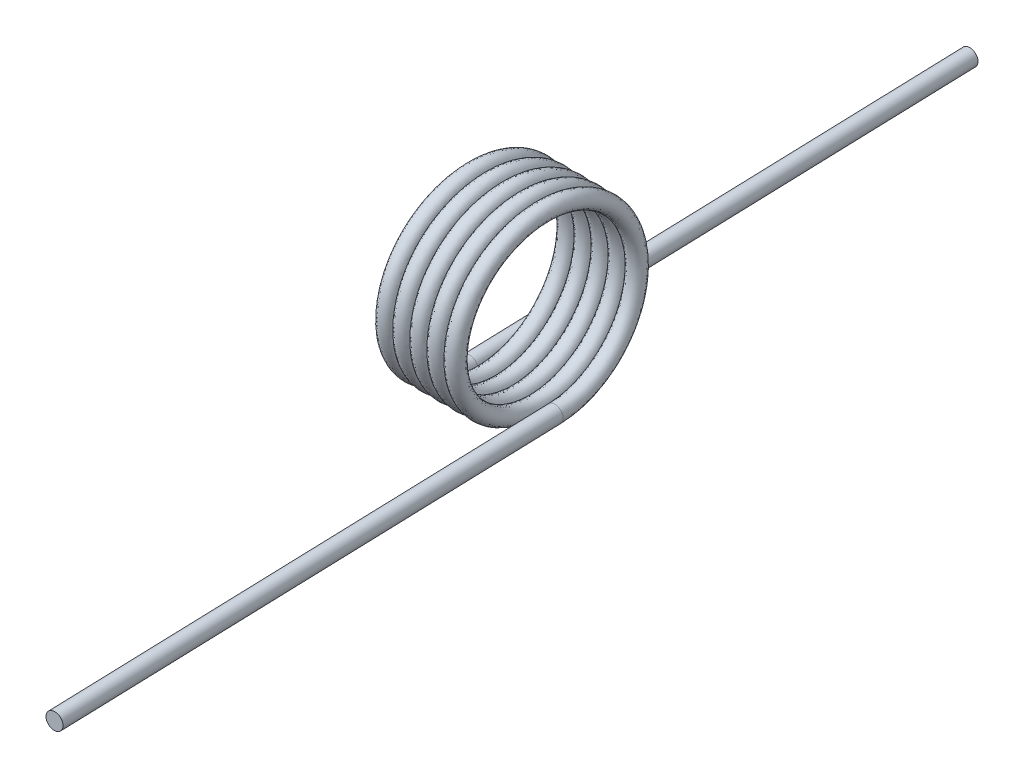
from build123d import *

# Parameters (mm, degrees)
SWEEP1_PITCH       = 0.8382
SWEEP1_HEIGHT      = 4.191
SWEEP1_RADIUS      = 4.2418
SWEEP1_START_ANGLE = 90
SKETCH2_R          = 0.4064
SKETCH3_R          = 0.4064
EXTRUDE1_DEPTH     = 25.4
SKETCH4_R          = 0.4064
EXTRUDE2_DEPTH     = 25.4


with BuildPart() as part:
    # Sweep1: sweep along a helix
    with BuildLine() as sweep1_path:
        add(Helix(SWEEP1_PITCH, SWEEP1_HEIGHT, SWEEP1_RADIUS, center=(0, 0, 0), direction=(1, 0, 0), lefthand=True, mode=Mode.PRIVATE).rotate(Axis((0, 0, 0), (1, 0, 0)), SWEEP1_START_ANGLE))
    # Sketch2 → Sweep1 (sweep)
    with BuildSketch(Plane(origin=(0, -4.2418, 0), x_dir=(0.9995058222539424, 2.668658098965613e-14, -0.031434237392861365), z_dir=(0.031434237392861365, -9.428430536528025e-15, 0.9995058222539424))):
        Circle(SKETCH2_R)
    sweep(path=sweep1_path.line, is_frenet=True)

    # Sketch3 → Extrude1 (add)
    with BuildSketch(Plane(origin=(0, 0, 0), x_dir=(-0.9995058222539424, -2.6658828077114365e-14, 0.031434237392861365), z_dir=(-0.031434237392861365, 9.428430536528027e-15, -0.9995058222539424))):
        with Locations(Location((0, -4.2418, 0), (0, 0, 180))):
            Circle(SKETCH3_R)
    extrude(amount=EXTRUDE1_DEPTH)

    # Sketch4 → Extrude2 (add)
    with BuildSketch(Plane(origin=(0.004141174, 0, 0.131675785), x_dir=(0.9958369441166065, -0.08560321397472057, -0.03131885198562091), z_dir=(0.031434237392861365, 6.391762119584143e-14, 0.9995058222539424))):
        with Locations(Location((4.536664346, -3.867643881, 0), (0, 0, 4.910712917))):
            Circle(SKETCH4_R)
    extrude(amount=EXTRUDE2_DEPTH)


solid = part.part
